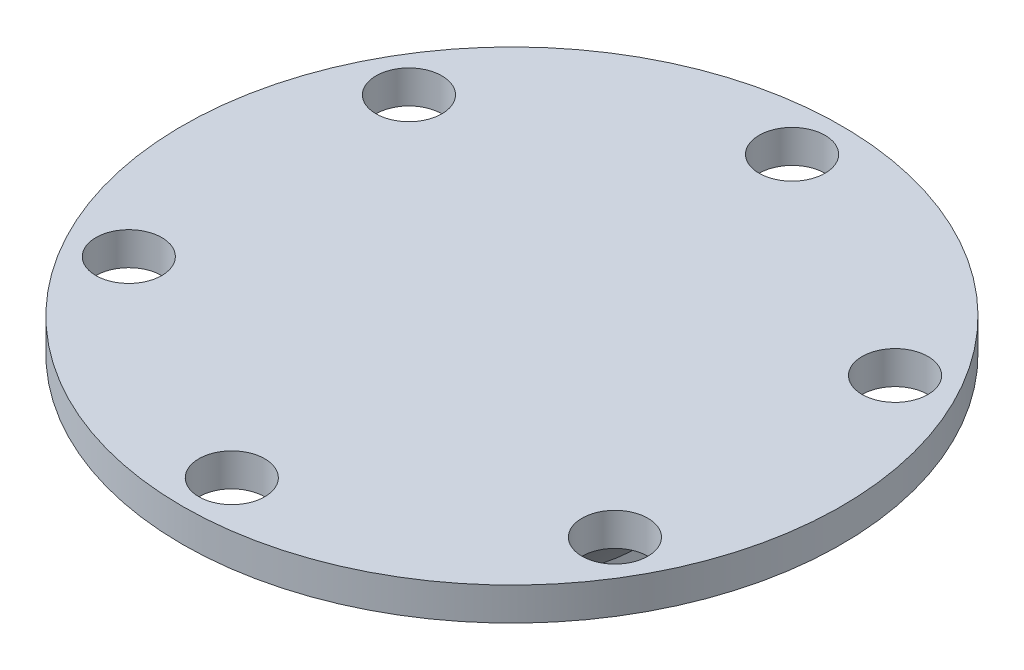
from build123d import *

# Parameters (mm, degrees)
SKETCH1_R           = 127
BOSS_EXTRUDE1_DEPTH = 12.7
SKETCH2_R           = 12.7
CUT_EXTRUDE1_DEPTH  = 12.7
SKETCH3_R           = 88.9
BOSS_EXTRUDE2_DEPTH = 39.6875
CHAMFER2_SIZE       = 39.6875
SKETCH4_R           = 49.2125
BOSS_EXTRUDE3_DEPTH = 4.7625


with BuildPart() as part:
    # Sketch1 → Boss-Extrude1 (new body)
    with BuildSketch(Plane(origin=(0, 0, 0), x_dir=(1, 0, 0), z_dir=(0, 1, 0))):
        with Locations(Location((0, 0, 0), (0, 0, 270))):
            Circle(SKETCH1_R)
    extrude(amount=BOSS_EXTRUDE1_DEPTH)

    # Sketch2 → Cut-Extrude1 (cut)
    with BuildSketch(Plane(origin=(0, 12.7, 0), x_dir=(1, 0, 0), z_dir=(0, 1, 0))):
        with Locations(Location((0, 107.95, 0), (0, 0, 270))):
            Circle(SKETCH2_R)
        with Locations(Location((0, -107.95, 0), (0, 0, 270))):
            Circle(SKETCH2_R)
        with Locations(Location((93.6625, -53.975, 0), (0, 0, 270))):
            Circle(SKETCH2_R)
        with Locations(Location((93.6625, 53.975, 0), (0, 0, 270))):
            Circle(SKETCH2_R)
        with Locations(Location((-93.6625, 53.975, 0), (0, 0, 270))):
            Circle(SKETCH2_R)
        with Locations(Location((-93.6625, -53.975, 0), (0, 0, 270))):
            Circle(SKETCH2_R)
    extrude(amount=-CUT_EXTRUDE1_DEPTH, mode=Mode.SUBTRACT)

    # Sketch3 → Boss-Extrude2 (add)
    with BuildSketch(Plane(origin=(0, 0, 0), x_dir=(-1, 0, 0), z_dir=(0, -1, 0))):
        with Locations(Location((0, 0, 0), (0, 0, 270))):
            Circle(SKETCH3_R)
    extrude(amount=BOSS_EXTRUDE2_DEPTH)

    # Chamfer2
    chamfer2_edges = [part.edges().sort_by_distance(p)[0] for p in [
        (0, -39.6875, -88.9),
    ]]
    chamfer(chamfer2_edges, length=CHAMFER2_SIZE - 0.0001)  # a hair under: the kernel refuses the full size

    # Sketch4 → Boss-Extrude3 (add)
    with BuildSketch(Plane.XZ.offset(39.6875)):
        with Locations(Location((0, 0, 0), (0, 0, 90))):
            Circle(SKETCH4_R)
    extrude(amount=BOSS_EXTRUDE3_DEPTH)


solid = part.part
